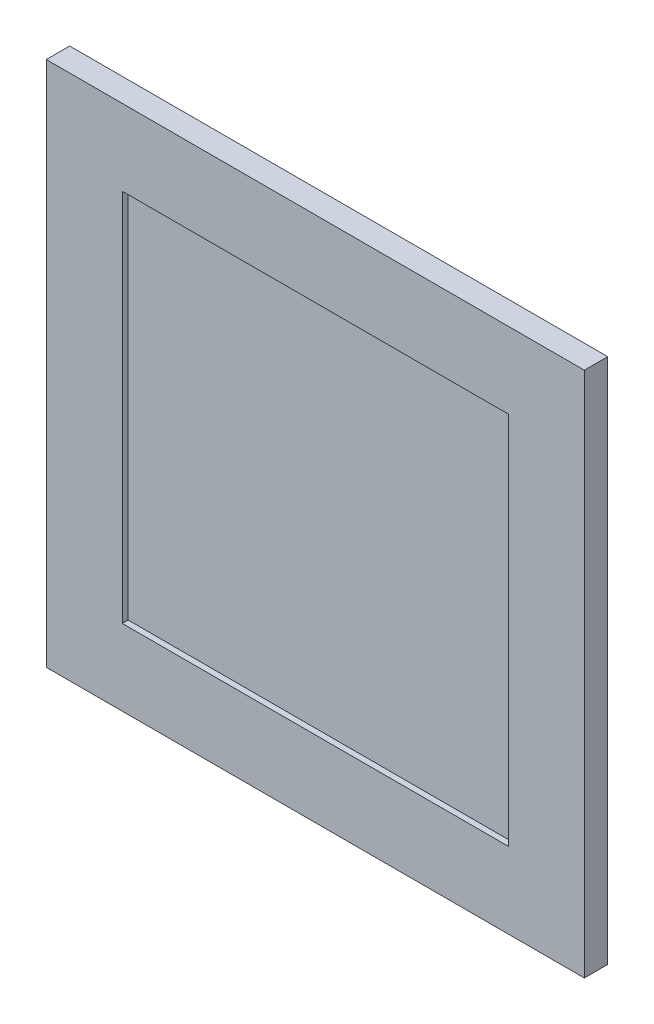
from build123d import *

# Parameters (mm, degrees)
SKETCH_2_W          = 460
SKETCH_2_H          = 450
EXTRUDE_1_DEPTH     = 20
SKETCH_3_W          = 330
SKETCH_3_H          = 320
CUT_EXTRUDE_1_DEPTH = 5


with BuildPart() as part:
    # 스케치2 → 보스-돌출1 (new body)
    with BuildSketch(Plane.XY):
        Rectangle(SKETCH_2_W, SKETCH_2_H)
    extrude(amount=EXTRUDE_1_DEPTH)

    # 스케치3 → 컷-돌출1 (cut)
    with BuildSketch(Plane.XY.offset(20)):
        Rectangle(SKETCH_3_W, SKETCH_3_H)
    extrude(amount=-CUT_EXTRUDE_1_DEPTH, mode=Mode.SUBTRACT)


solid = part.part
